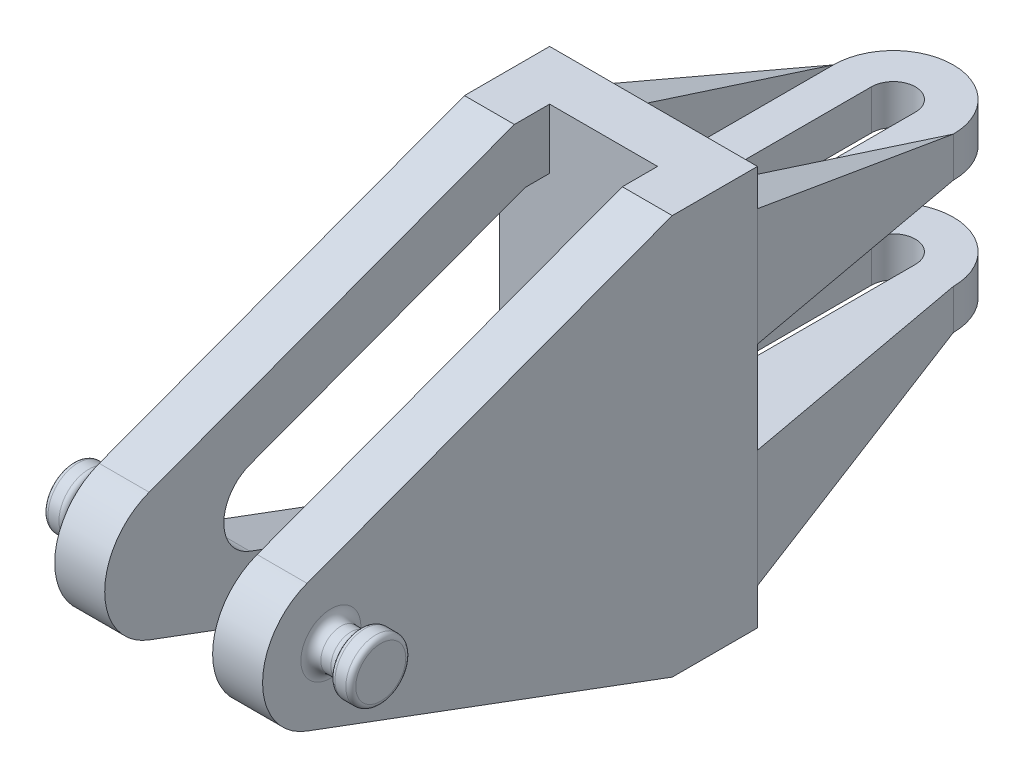
from build123d import *

# Parameters (mm, degrees)
BOSS_EXTRUDE1_DEPTH = 40
CUT_EXTRUDE1_DEPTH  = 40
SKETCH4_R           = 2
BOSS_EXTRUDE2_DEPTH = 3
SKETCH5_R           = 3
BOSS_EXTRUDE3_DEPTH = 2
BOSS_EXTRUDE4_START = 3
SKETCH6_R           = 2
BOSS_EXTRUDE4_DEPTH = 3
BOSS_EXTRUDE5_START = 2
SKETCH7_R           = 3
BOSS_EXTRUDE5_DEPTH = 2
FILLET1_R           = 1
FILLET2_R           = 0.5
CUT_EXTRUDE2_DEPTH  = 5
SKETCH10_W          = 12
SKETCH10_H          = 4
BOSS_EXTRUDE6_DEPTH = 30
CUT_EXTRUDE3_DEPTH  = 30
CUT_EXTRUDE4_DEPTH  = 30
BOSS_EXTRUDE7_DEPTH = 4.4
BOSS_EXTRUDE8_DEPTH = 4.4
CUT_EXTRUDE5_DEPTH  = 98.419915828


with BuildPart() as part:
    # Sketch1 → Boss-Extrude1 (new body)
    with BuildSketch(Plane(origin=(0, 0, 0), x_dir=(1, 0, 0), z_dir=(0, 1, 0))):
        Polygon((15.8, 0), (20.8, 0), (20.8, 55), (0, 55), (0, 0), (5, 0), (5, 50), (15.8, 50), align=None)
    extrude(amount=BOSS_EXTRUDE1_DEPTH)

    # Sketch2 → Cut-Extrude1 (cut)
    with BuildSketch(Plane(origin=(20.8, 0, 0), x_dir=(0, 0, -1), z_dir=(1, 0, 0))):
        with BuildLine():
            Line((46.47425335, 40), (9.923124303, 26.402732374))
            ThreePointArc((9.923124303, 26.402732374), (5.473754278, 20.00031105), (9.923042079, 13.597832585))
            Line((9.923042079, 13.597832585), (46.47425335, 0))
            Line((46.47425335, 0), (0, 0))
            Line((0, 0), (0, 40))
            Line((0, 40), (46.47425335, 40))
        make_face()
    extrude(amount=-CUT_EXTRUDE1_DEPTH, mode=Mode.SUBTRACT)

    # Sketch4 → Boss-Extrude2 (add)
    with BuildSketch(Plane.ZY):
        with Locations(Location((-12.304884727, 20.000267186, 0), (0, 0, 180))):
            Circle(SKETCH4_R)
    extrude(amount=BOSS_EXTRUDE2_DEPTH)

    # Sketch5 → Boss-Extrude3 (add)
    with BuildSketch(Plane.ZY.offset(3)):
        with Locations((-12.304884727, 20.000267186)):
            Circle(SKETCH5_R)
    extrude(amount=BOSS_EXTRUDE3_DEPTH)

    # Sketch6 → Boss-Extrude4 (add)
    with BuildSketch(Plane(origin=(20.8, 0, 0), x_dir=(0, 0, -1), z_dir=(1, 0, 0)).offset(BOSS_EXTRUDE4_START)):
        with Locations((12.304884727, 20.000267186)):
            Circle(SKETCH6_R)
    extrude(amount=-BOSS_EXTRUDE4_DEPTH)

    # Sketch7 → Boss-Extrude5 (add)
    with BuildSketch(Plane(origin=(23.8, 0, 0), x_dir=(0, 0, -1), z_dir=(1, 0, 0)).offset(BOSS_EXTRUDE5_START)):
        with Locations(Location((12.304884727, 20.000267186, 0), (0, 0, 180))):
            Circle(SKETCH7_R)
    extrude(amount=-BOSS_EXTRUDE5_DEPTH)

    # Fillet1
    fillet1_edges = [part.edges().sort_by_distance(p)[0] for p in [
        (0, 20.000267186, -10.304884727),
        (-3, 20.000267186, -10.304884727),
        (20.8, 20.000267186, -10.304884727),
        (23.8, 20.000267186, -10.304884727),
    ]]
    fillet(fillet1_edges, radius=FILLET1_R - 0.0001)  # a hair under: the kernel refuses the full size

    # Fillet2
    fillet2_edges = [part.edges().sort_by_distance(p)[0] for p in [
        (-3, 20.000267186, -15.304884727),
        (-5, 20.000267186, -15.304884727),
        (23.8, 20.000267186, -15.304884727),
        (25.8, 20.000267186, -15.304884727),
    ]]
    fillet(fillet2_edges, radius=FILLET2_R)

    # Sketch8 → Cut-Extrude2 (cut)
    with BuildSketch(Plane.ZY):
        with BuildLine():
            Line((-50, 34), (-50, 6))
            Line((-50, 6), (-47.554163097, 6))
            Line((-47.554163097, 6), (-19.998668132, 16.251233661))
            ThreePointArc((-19.998668132, 16.251233661), (-17.393367101, 20.000234511), (-19.998716278, 23.749201902))
            Line((-19.998716278, 23.749201902), (-47.554123321, 34))
            Line((-47.554123321, 34), (-50, 34))
        make_face()
    extrude(amount=-CUT_EXTRUDE2_DEPTH, mode=Mode.SUBTRACT)

    # Sketch10 → Boss-Extrude6 (add)
    with BuildSketch(Plane(origin=(0, 0, -55), x_dir=(-1, 0, 0), z_dir=(0, 0, -1))):
        with Locations((-10.4, 26.6)):
            Rectangle(SKETCH10_W, SKETCH10_H)
        with Locations((-10.4, 13.4)):
            Rectangle(SKETCH10_W, SKETCH10_H)
    extrude(amount=BOSS_EXTRUDE6_DEPTH)

    # Sketch11 → Cut-Extrude3 (cut)
    with BuildSketch(Plane.XZ.offset(-11.4)):
        with BuildLine():
            ThreePointArc((16.4, -79), (14.642640687, -83.242640687), (10.4, -85))
            Line((10.4, -85), (16.4, -85))
            Line((16.4, -85), (16.4, -79))
        make_face()
        with BuildLine():
            ThreePointArc((10.4, -85), (6.157359313, -83.242640687), (4.4, -79))
            Line((4.4, -79), (4.4, -85))
            Line((4.4, -85), (10.4, -85))
        make_face()
    extrude(amount=-CUT_EXTRUDE3_DEPTH, mode=Mode.SUBTRACT)

    # Sketch12 → Cut-Extrude4 (cut)
    with BuildSketch(Plane.XZ.offset(-11.4)):
        with BuildLine():
            Line((8.2, -79), (8.2, -55))
            Line((8.2, -55), (12.6, -55))
            Line((12.6, -55), (12.6, -79))
            ThreePointArc((12.6, -79), (10.4, -81.2), (8.2, -79))
        make_face()
    extrude(amount=-CUT_EXTRUDE4_DEPTH, mode=Mode.SUBTRACT)

    # Sketch13 → Boss-Extrude7 (add)
    with BuildSketch(Plane(origin=(16.4, 0, 0), x_dir=(0, 0, -1), z_dir=(1, 0, 0))):
        Polygon((55, 28.6), (55, 36.335747803), (79, 28.6), (79, 24.6), (55, 24.6), align=None)
        Polygon((55, 3.664252197), (79, 11.4), (79, 15.4), (55, 15.4), (55, 11.4), align=None)
    extrude(amount=BOSS_EXTRUDE7_DEPTH)

    # Sketch14 → Boss-Extrude8 (add)
    with BuildSketch(Plane.ZY.offset(-4.4)):
        Polygon((-55, 3.664252197), (-79, 11.4), (-79, 15.4), (-55, 15.4), align=None)
        Polygon((-79, 24.6), (-79, 28.6), (-55, 36.335747803), (-55, 24.6), align=None)
    extrude(amount=BOSS_EXTRUDE8_DEPTH)

    # Sketch15 → Cut-Extrude5 (cut, through all)
    with BuildSketch(Plane.XZ):
        Polygon((16.4, -79), (20.8, -55), (20.8, -79), align=None)
        Polygon((4.4, -79), (0, -55), (0, -79), align=None)
    extrude(amount=-CUT_EXTRUDE5_DEPTH, mode=Mode.SUBTRACT)


solid = part.part
